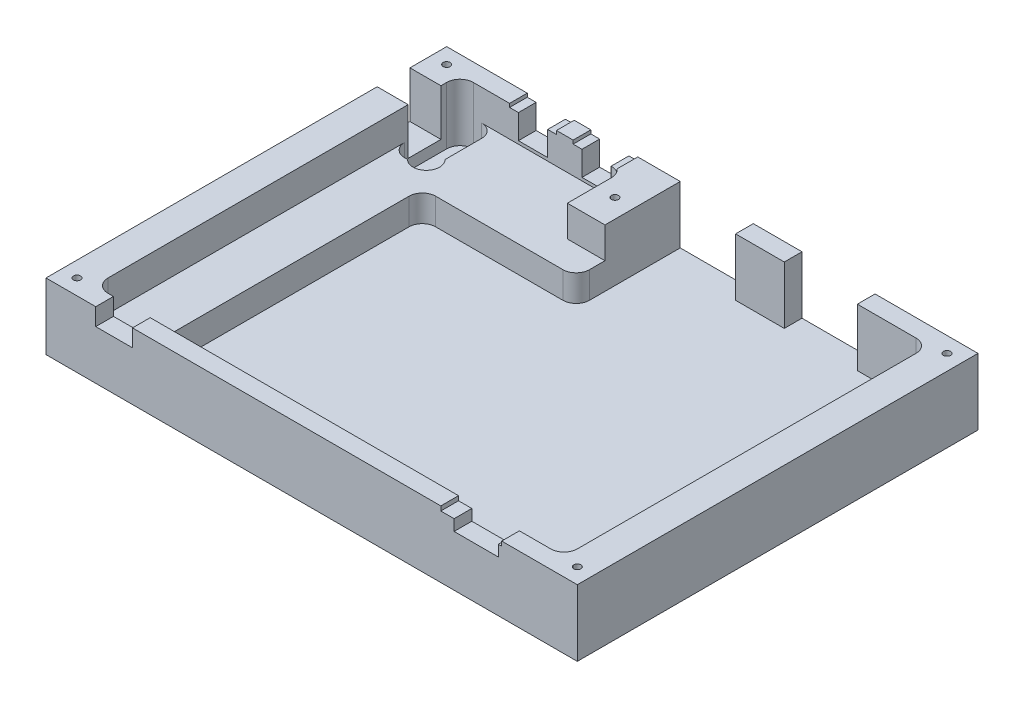
from build123d import *

# Parameters (mm, degrees)
SKETCH_1_R                  = 0.0001
EXTRUDE_3486_DEPTH          = 15
SKETCH_3_W                  = 106
SKETCH_3_H                  = 82.5
CUT_EXTRUDE_5664_DEPTH      = 7
PHONEJACK_CENTER_DEPTH      = 6.3
SKETCH_2_10_W               = 10.6
SKETCH_2_10_H               = 13.1
PHONEJACK_PADS_DEPTH        = 0.8
MICJACK_START               = -13
MICJACK_DEPTH               = 13
ENCODER_BODY_DEPTH          = 13
SKETCH_2_13_W               = 7
SKETCH_2_13_H               = 7.4
ENCODER_SHAFT_DEPTH         = 10.5
SKETCH_2_14_W               = 8.3
SKETCH_2_14_H               = 5
SW_DEPTH                    = 3.9
USB_DEPTH                   = 3.5
SKETCH_2_16_W               = 11.5
SKETCH_2_16_H               = 8
SKETCH_2_16_W_2             = 3
USB_PADS_DEPTH              = 1
HOLE_WIZARD_8269_D          = 1.6
HOLE_WIZARD_8269_DEPTH      = 8
HOLE_WIZARD_8269_TIP        = 0.480688495
SKETCH_15_W                 = 8.5
SKETCH_15_H                 = 13
EXTRUDE_11487_DEPTH         = 7
HOLE_WIZARD_1_6_1_6_1_D     = 1.6
HOLE_WIZARD_1_6_1_6_1_DEPTH = 8
HOLE_WIZARD_1_6_1_6_1_TIP   = 0.480688495
CUT_EXTRUDE_START           = -13
CUT_EXTRUDE_12334_DEPTH     = 13
CUT_EXTRUDE_12754_DEPTH     = 13
FILLET_2_R                  = 3


# Read off the part's stored shape, not the designer's step: micjack
with BuildPart() as part:
    # 草图1 → Extrude 3486 (new body)
    with BuildSketch(Plane(origin=(0, 0, 0), x_dir=(1, 0, 0), z_dir=(0, 1, 0))):
        with Locations((-59.9999, 45.2499)):
            Circle(SKETCH_1_R)
        with BuildLine():
            Line((-59.999, -45.25), (59.999, -45.25))
            ThreePointArc((59.999, -45.25), (59.999707107, -45.249707107), (60, -45.249))
            Line((60, -45.249), (60, 45.249))
            ThreePointArc((60, 45.249), (59.999707107, 45.249707107), (59.999, 45.25))
            Line((59.999, 45.25), (-60, 45.2499))
            Line((-60, 45.2499), (-60, -45.249))
            ThreePointArc((-60, -45.249), (-59.999707107, -45.249707107), (-59.999, -45.25))
        make_face()
    extrude(amount=EXTRUDE_3486_DEPTH)

    # 草图3 → Cut-Extrude 5664 (cut)
    with BuildSketch(Plane(origin=(0, 15, 0), x_dir=(1, 0, 0), z_dir=(0, 1, 0))):
        Rectangle(SKETCH_3_W, SKETCH_3_H)
    extrude(amount=-CUT_EXTRUDE_5664_DEPTH, mode=Mode.SUBTRACT)

    # 草图2 → phonejack_center (cut)
    with BuildSketch(Plane(origin=(0, 15, 0), x_dir=(1, 0, 0), z_dir=(0, 1, 0))):
        Polygon((-18.845, 45.25), (-25.445, 45.25), (-25.445, 34.892640687), (-25.445, 32.15), (-18.845, 32.15), (-18.845, 34.892640687), align=None)
        with BuildLine():
            Line((-25.445, 32.15), (-25.445, 34.892640687))
            ThreePointArc((-25.445, 34.892640687), (-26.199788077, 33.62454971), (-26.258634687, 32.15))
            Line((-26.258634687, 32.15), (-25.445, 32.15))
        make_face()
        with BuildLine():
            Line((-25.445, 32.15), (-26.258634687, 32.15))
            ThreePointArc((-26.258634687, 32.15), (-25.960719695, 31.340928846), (-25.445, 30.65))
            Line((-25.445, 30.65), (-25.445, 32.15))
        make_face()
        with BuildLine():
            Line((-23.087640687, 30.65), (-25.445, 30.65))
            ThreePointArc((-25.445, 30.65), (-23.892646037, 29.825768229), (-22.145, 30.012568041))
            ThreePointArc((-22.145, 30.012568041), (-22.646820232, 30.286180483), (-23.087640687, 30.65))
        make_face()
        with BuildLine():
            Line((-21.202359313, 30.65), (-23.087640687, 30.65))
            ThreePointArc((-23.087640687, 30.65), (-22.646820232, 30.286180483), (-22.145, 30.012568041))
            ThreePointArc((-22.145, 30.012568041), (-21.643179768, 30.286180483), (-21.202359313, 30.65))
        make_face()
        with BuildLine():
            ThreePointArc((-21.202359313, 30.65), (-21.643179768, 30.286180483), (-22.145, 30.012568041))
            ThreePointArc((-22.145, 30.012568041), (-20.397353963, 29.825768229), (-18.845, 30.65))
            Line((-18.845, 30.65), (-21.202359313, 30.65))
        make_face()
        with BuildLine():
            ThreePointArc((-18.031365313, 32.15), (-18.090211923, 33.62454971), (-18.845, 34.892640687))
            Line((-18.845, 34.892640687), (-18.845, 32.15))
            Line((-18.845, 32.15), (-18.031365313, 32.15))
        make_face()
        with BuildLine():
            Line((-18.031365313, 32.15), (-18.845, 32.15))
            Line((-18.845, 32.15), (-18.845, 30.65))
            ThreePointArc((-18.845, 30.65), (-18.329280305, 31.340928846), (-18.031365313, 32.15))
        make_face()
        Polygon((-18.845, 32.15), (-25.445, 32.15), (-25.445, 30.65), (-23.087640687, 30.65), (-21.202359313, 30.65), (-18.845, 30.65), align=None)
        Polygon((-33.2, 45.25), (-39.8, 45.25), (-39.8, 34.892640687), (-39.8, 32.15), (-33.2, 32.15), (-33.2, 34.892640687), align=None)
        with BuildLine():
            Line((-39.8, 32.15), (-39.8, 34.892640687))
            ThreePointArc((-39.8, 34.892640687), (-40.554788077, 33.62454971), (-40.613634687, 32.15))
            Line((-40.613634687, 32.15), (-39.8, 32.15))
        make_face()
        with BuildLine():
            Line((-39.8, 30.65), (-39.8, 32.15))
            Line((-39.8, 32.15), (-40.613634687, 32.15))
            ThreePointArc((-40.613634687, 32.15), (-40.315719695, 31.340928846), (-39.8, 30.65))
        make_face()
        with BuildLine():
            Line((-37.442640687, 30.65), (-39.8, 30.65))
            ThreePointArc((-39.8, 30.65), (-38.247646037, 29.825768229), (-36.5, 30.012568041))
            ThreePointArc((-36.5, 30.012568041), (-37.001820232, 30.286180483), (-37.442640687, 30.65))
        make_face()
        with BuildLine():
            ThreePointArc((-36.5, 30.012568041), (-34.752353963, 29.825768229), (-33.2, 30.65))
            Line((-33.2, 30.65), (-35.557359313, 30.65))
            ThreePointArc((-35.557359313, 30.65), (-35.998179768, 30.286180483), (-36.5, 30.012568041))
        make_face()
        with BuildLine():
            Line((-35.557359313, 30.65), (-37.442640687, 30.65))
            ThreePointArc((-37.442640687, 30.65), (-37.001820232, 30.286180483), (-36.5, 30.012568041))
            ThreePointArc((-36.5, 30.012568041), (-35.998179768, 30.286180483), (-35.557359313, 30.65))
        make_face()
        Polygon((-33.2, 32.15), (-39.8, 32.15), (-39.8, 30.65), (-37.442640687, 30.65), (-35.557359313, 30.65), (-33.2, 30.65), align=None)
        with BuildLine():
            ThreePointArc((-32.386365313, 32.15), (-32.445211923, 33.62454971), (-33.2, 34.892640687))
            Line((-33.2, 34.892640687), (-33.2, 32.15))
            Line((-33.2, 32.15), (-32.386365313, 32.15))
        make_face()
        with BuildLine():
            Line((-32.386365313, 32.15), (-33.2, 32.15))
            Line((-33.2, 32.15), (-33.2, 30.65))
            ThreePointArc((-33.2, 30.65), (-32.684280305, 31.340928846), (-32.386365313, 32.15))
        make_face()
    extrude(amount=-PHONEJACK_CENTER_DEPTH, mode=Mode.SUBTRACT)

    # 草图2<10> → phonejack_pads (cut)
    with BuildSketch(Plane(origin=(0, 15, 0), x_dir=(1, 0, 0), z_dir=(0, 1, 0))):
        with Locations((-36.5, 38.7)):
            Rectangle(SKETCH_2_10_W, SKETCH_2_10_H)
        with Locations((-22.145, 38.7)):
            Rectangle(SKETCH_2_10_W, SKETCH_2_10_H)
    extrude(amount=-PHONEJACK_PADS_DEPTH, mode=Mode.SUBTRACT)

    # micjack outline → micjack (cut)
    with BuildSketch(Plane(origin=(0, 15, 0), x_dir=(1, 0, 0), z_dir=(0, 1, 0)).offset(MICJACK_START)):
        with BuildLine():
            Line((53, 21.75), (53, 41.25))
            Line((53, 41.25), (36.75, 41.25))
            Line((36.75, 41.25), (36.75, 45.25))
            Line((36.75, 45.25), (20.25, 45.25))
            Line((20.25, 45.25), (20.25, 23.492640687))
            ThreePointArc((20.25, 23.492640687), (20.25, 19.25), (24.492640687, 19.25))
            Line((24.492640687, 19.25), (33.921572875, 19.25))
            ThreePointArc((33.921572875, 19.25), (36.592809886, 19.108613341), (37.015389906, 21.75))
            Line((37.015389906, 21.75), (53, 21.75))
        make_face()
        with BuildLine():
            Line((-7.25, 45.25), (-7.25, 21.75))
            Line((-7.25, 21.75), (-8.104683977, 21.75))
            ThreePointArc((-8.104683977, 21.75), (-6.449710003, 18.677832117), (-3.007359313, 19.25))
            Line((-3.007359313, 19.25), (5.007359313, 19.25))
            ThreePointArc((5.007359313, 19.25), (9.25, 19.25), (9.25, 23.492640687))
            Line((9.25, 23.492640687), (9.25, 45.25))
            Line((9.25, 45.25), (-7.25, 45.25))
        make_face()
    extrude(amount=MICJACK_DEPTH, mode=Mode.SUBTRACT)

    # 草图2<12> → encoder_body (cut)
    with BuildSketch(Plane(origin=(0, 15, 0), x_dir=(1, 0, 0), z_dir=(0, 1, 0))):
        with BuildLine():
            Line((-53, 41.25), (-53, 25.75))
            Line((-53, 25.75), (-49.342640687, 25.75))
            ThreePointArc((-49.342640687, 25.75), (-45.1, 25.75), (-45.1, 29.992640687))
            Line((-45.1, 29.992640687), (-45.1, 41.25))
            Line((-45.1, 41.25), (-53, 41.25))
        make_face()
    extrude(amount=-ENCODER_BODY_DEPTH, mode=Mode.SUBTRACT)

    # 草图2<13> → encoder_shaft (cut)
    with BuildSketch(Plane(origin=(0, 15, 0), x_dir=(1, 0, 0), z_dir=(0, 1, 0))):
        with Locations((-56.5, 33.25)):
            Rectangle(SKETCH_2_13_W, SKETCH_2_13_H)
    extrude(amount=-ENCODER_SHAFT_DEPTH, mode=Mode.SUBTRACT)

    # 草图2<14> → sw (cut)
    with BuildSketch(Plane(origin=(0, 15, 0), x_dir=(1, 0, 0), z_dir=(0, 1, 0))):
        with Locations((-44.615, -42.75)):
            Rectangle(SKETCH_2_14_W, SKETCH_2_14_H)
    extrude(amount=-SW_DEPTH, mode=Mode.SUBTRACT)

    # 草图2<15> → USB (cut)
    with BuildSketch(Plane(origin=(0, 15, 0), x_dir=(1, 0, 0), z_dir=(0, 1, 0))):
        Polygon((32.17, -41.492640687), (32.17, -45.25), (42.17, -45.25), (42.17, -41.492640687), (42.17, -41.25), (32.17, -41.25), align=None)
    extrude(amount=-USB_DEPTH, mode=Mode.SUBTRACT)

    # 草图2<16> → USB_pads (cut)
    with BuildSketch(Plane(origin=(0, 15, 0), x_dir=(1, 0, 0), z_dir=(0, 1, 0))):
        with Locations((37.17, -41.25)):
            Rectangle(SKETCH_2_16_W, SKETCH_2_16_H)
        with Locations((30.67, -41.25)):
            Rectangle(SKETCH_2_16_W_2, SKETCH_2_16_H)
    extrude(amount=-USB_PADS_DEPTH, mode=Mode.SUBTRACT)

    # Hole Wizard 8269
    with Locations(Plane(origin=(0, 15, 0), x_dir=(1, 0, 0), z_dir=(0, 1, 0))):
        with Locations((56.5, -41.75), (56.5, 41.75), (-56.5, 41.75), (-56.5, -41.75)):
            Hole(HOLE_WIZARD_8269_D / 2, depth=HOLE_WIZARD_8269_DEPTH)
            with Locations((0, 0, -(HOLE_WIZARD_8269_DEPTH + HOLE_WIZARD_8269_TIP / 2))):  # 118° drill point
                Cone(0, HOLE_WIZARD_8269_D / 2, HOLE_WIZARD_8269_TIP, mode=Mode.SUBTRACT)

    # 草图15 → Extrude 11487 (add)
    with BuildSketch(Plane(origin=(0, 8, 0), x_dir=(1, 0, 0), z_dir=(0, 1, 0))):
        with Locations((-11.5, 34.75)):
            Rectangle(SKETCH_15_W, SKETCH_15_H)
    extrude(amount=EXTRUDE_11487_DEPTH)

    # Ø1.6 (1.6) 直径孔1
    with Locations(Plane(origin=(0, 15, 0), x_dir=(1, 0, 0), z_dir=(0, 1, 0))):
        with Locations((-11.5, 34.75)):
            Hole(HOLE_WIZARD_1_6_1_6_1_D / 2, depth=HOLE_WIZARD_1_6_1_6_1_DEPTH)
            with Locations((0, 0, -(HOLE_WIZARD_1_6_1_6_1_DEPTH + HOLE_WIZARD_1_6_1_6_1_TIP / 2))):  # 118° drill point
                Cone(0, HOLE_WIZARD_1_6_1_6_1_D / 2, HOLE_WIZARD_1_6_1_6_1_TIP, mode=Mode.SUBTRACT)

    # 草图2<18> → Cut-Extrude 12334 (cut)
    with BuildSketch(Plane(origin=(0, 15, 0), x_dir=(1, 0, 0), z_dir=(0, 1, 0)).offset(CUT_EXTRUDE_START)):
        with BuildLine():
            Line((53, -41.25), (53, 21.75))
            Line((53, 21.75), (37.015389906, 21.75))
            ThreePointArc((37.015389906, 21.75), (36.592809886, 19.108613341), (33.921572875, 19.25))
            Line((33.921572875, 19.25), (24.492640687, 19.25))
            ThreePointArc((24.492640687, 19.25), (21.050289997, 18.677832117), (19.395316023, 21.75))
            Line((19.395316023, 21.75), (10.104683977, 21.75))
            ThreePointArc((10.104683977, 21.75), (8.449710003, 18.677832117), (5.007359313, 19.25))
            Line((5.007359313, 19.25), (-3.007359313, 19.25))
            ThreePointArc((-3.007359313, 19.25), (-6.449710003, 18.677832117), (-8.104683977, 21.75))
            Line((-8.104683977, 21.75), (-42, 21.75))
            Line((-42, 21.75), (-42, -41.25))
            Line((-42, -41.25), (53, -41.25))
        make_face()
    extrude(amount=CUT_EXTRUDE_12334_DEPTH, mode=Mode.SUBTRACT)

    # 草图2<20> → Cut-Extrude 12754 (cut)
    with BuildSketch(Plane(origin=(0, 15, 0), x_dir=(1, 0, 0), z_dir=(0, 1, 0)).offset(CUT_EXTRUDE_START)):
        with BuildLine():
            ThreePointArc((19.395316023, 21.75), (19.677832117, 22.69235069), (20.25, 23.492640687))
            Line((20.25, 23.492640687), (20.25, 41.25))
            Line((20.25, 41.25), (9.25, 41.25))
            Line((9.25, 41.25), (9.25, 23.492640687))
            ThreePointArc((9.25, 23.492640687), (9.822167883, 22.69235069), (10.104683977, 21.75))
            Line((10.104683977, 21.75), (19.395316023, 21.75))
        make_face()
    extrude(amount=CUT_EXTRUDE_12754_DEPTH, mode=Mode.SUBTRACT)

    # 圆角2
    fillet_2_edges = [part.edges().sort_by_distance(p)[0] for p in [
        (-7.25, 5, -21.75),
        (53, 8.5, -41.25),
        (53, 8.5, 41.25),
        (-53, 5, -25.75),
        (-42, 5, -21.75),
        (-42, 5, 41.25),
        (-53, 11.5, 41.25),
        (-53, 8.5, -41.25),
        (-15.75, 11.5, -41.25),
        (-45.1, 5, -41.25),
    ]]
    fillet(fillet_2_edges, radius=FILLET_2_R)


solid = part.part
